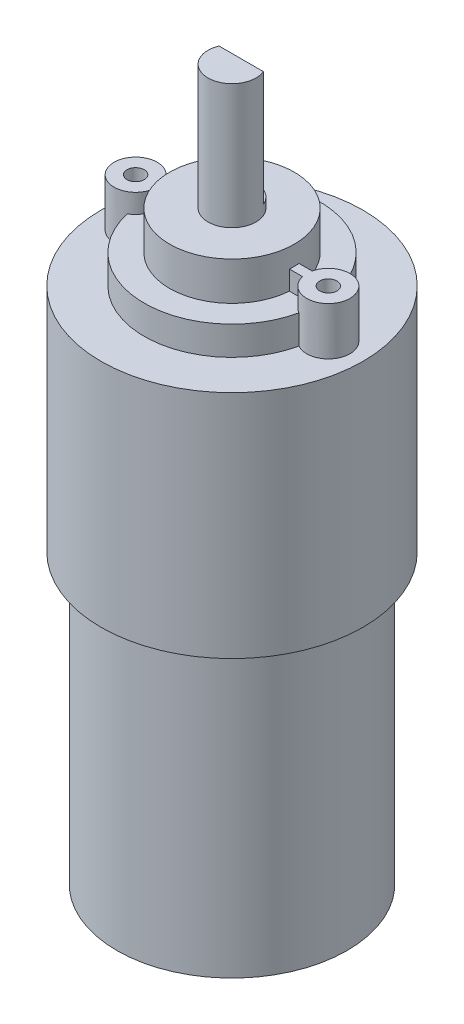
from build123d import *

# Parameters (mm, degrees)
CORTAR_EXTRUIR1_START   = -12
CORTAR_EXTRUIR1_DEPTH   = 12
CROQUIS4_R              = 0.9
SALIENTE_EXTRUIR1_DEPTH = 5


with BuildPart() as part:
    # Croquis1 → Revolución1 (revolve)
    with BuildSketch(Plane.XY):
        Polygon((0, -30.5), (0, 43.5), (-2.5, 43.5), (-2.5, 30.5), (-6.5, 30.5), (-6.5, 26.5), (-9.15, 26.5), (-9.15, 23.5), (-13.65, 23.5), (-13.65, -0.5), (-12, -0.5), (-12, -30.5), align=None)
    revolve(axis=Axis((0, 65.687156563, 0), (0, -1, 0)))

    # Croquis2 → Cortar-Extruir1 (cut)
    with BuildSketch(Plane(origin=(0, 43.5, 0), x_dir=(1, 0, 0), z_dir=(0, 1, 0)).offset(CORTAR_EXTRUIR1_START)):
        with BuildLine():
            ThreePointArc((2.308332732, 0.96), (0, 2.5), (-2.308332732, 0.96))
            Line((-2.308332732, 0.96), (2.308332732, 0.96))
        make_face()
    extrude(amount=CORTAR_EXTRUIR1_DEPTH, mode=Mode.SUBTRACT)

    # Croquis4 → Saliente-Extruir1 (add)
    with BuildSketch(Plane(origin=(0, 23.5, 0), x_dir=(1, 0, 0), z_dir=(0, 1, 0))):
        with BuildLine():
            ThreePointArc((7.846258903, -0.5), (12.29, 0), (7.846258903, 0.5))
            Line((7.846258903, 0.5), (-7.846258903, 0.5))
            ThreePointArc((-7.846258903, 0.5), (-12.29, 0), (-7.846258903, -0.5))
            Line((-7.846258903, -0.5), (7.846258903, -0.5))
        make_face()
        with Locations((10.04, 0)):
            Circle(CROQUIS4_R, mode=Mode.SUBTRACT)
        with Locations((-10.04, 0)):
            Circle(CROQUIS4_R, mode=Mode.SUBTRACT)
    extrude(amount=SALIENTE_EXTRUIR1_DEPTH)


solid = part.part
